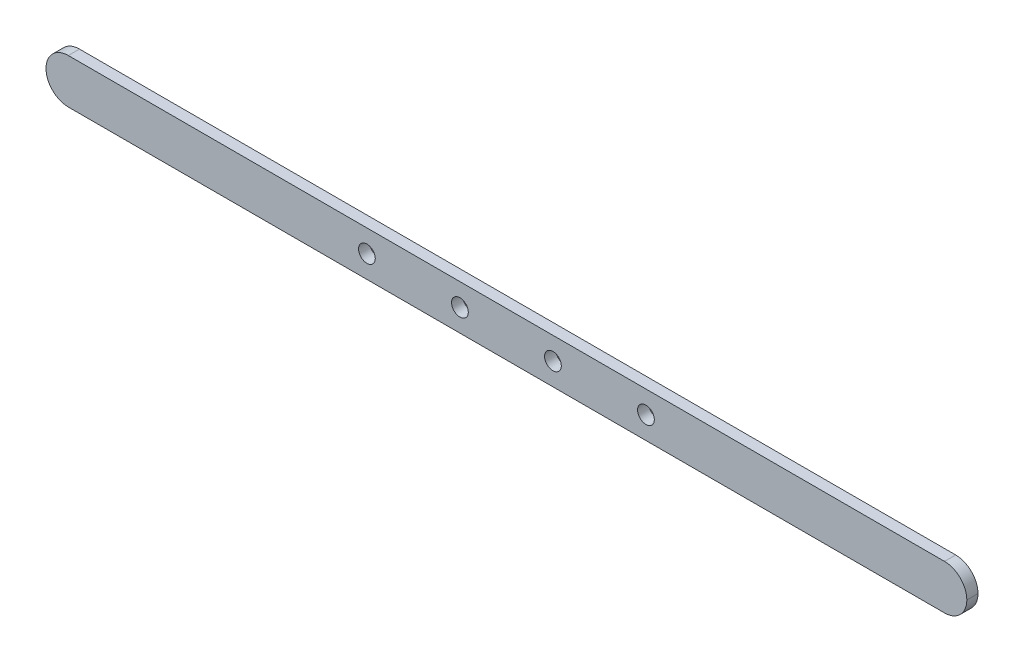
from build123d import *

# Parameters (mm, degrees)
SKETCH1_W           = 495
SKETCH1_H           = 24
SKETCH1_R           = 4.5
BOSS_EXTRUDE1_DEPTH = 6
FILLET2_R           = 12


with BuildPart() as part:
    # Sketch1 → Boss-Extrude1 (new body)
    with BuildSketch(Plane.XY):
        Rectangle(SKETCH1_W, SKETCH1_H)
        with Locations((75, 0)):
            Circle(SKETCH1_R, mode=Mode.SUBTRACT)
        with Locations((25, 0)):
            Circle(SKETCH1_R, mode=Mode.SUBTRACT)
        with Locations((-25, 0)):
            Circle(SKETCH1_R, mode=Mode.SUBTRACT)
        with Locations((-75, 0)):
            Circle(SKETCH1_R, mode=Mode.SUBTRACT)
    extrude(amount=BOSS_EXTRUDE1_DEPTH)

    # Fillet2
    fillet2_edges = [part.edges().sort_by_distance(p)[0] for p in [
        (-247.5, -12, 3),
        (-247.5, 12, 3),
        (247.5, 12, 3),
        (247.5, -12, 3),
    ]]
    fillet(fillet2_edges, radius=FILLET2_R - 0.0001)  # a hair under: the kernel refuses the full size


solid = part.part
